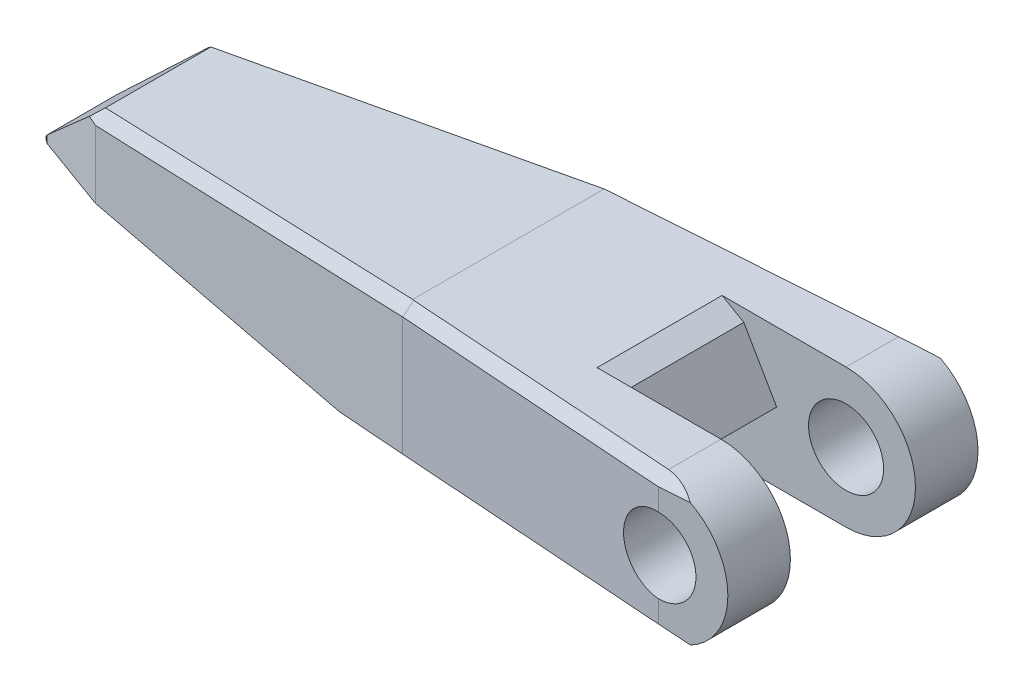
from build123d import *

# Parameters (mm, degrees)
CROQUIS1_W              = 20
CROQUIS1_H              = 27.748412894
CROQUIS1_R              = 7.5
SALIENTE_EXTRUIR1_DEPTH = 50
CORTAR_EXTRUIR4_DEPTH   = 50
CORTAR_EXTRUIR6_DEPTH   = 12.5
CHAFL_N3_START          = -1
CHAFL_N3_OUTLINE_W      = 79
CHAFL_N3_OUTLINE_H      = 9
CHAFL_N3_DEPTH          = 2.185479897
CHAFL_N4_SIZE           = 2
CHAFL_N4_SIZE_2         = 2.02158655
CHAFL_N5_START          = -33
CHAFL_N5_OUTLINE_W      = 90
CHAFL_N5_OUTLINE_H      = 7
CHAFL_N5_DEPTH          = 2.187491538
CHAFL_N6_START          = -47
CHAFL_N6_OUTLINE_W      = 78
CHAFL_N6_OUTLINE_H      = 9
CHAFL_N6_DEPTH          = 1.956109558
CHAFL_N9_START          = -12
CHAFL_N9_OUTLINE_W      = 79
CHAFL_N9_OUTLINE_H      = 9
CHAFL_N9_DEPTH          = 2.225324788
CHAFL_N10_START         = -36
CHAFL_N10_OUTLINE_W     = 65
CHAFL_N10_OUTLINE_H     = 9
CHAFL_N10_DEPTH         = 1.916264666
CROQUIS17_W             = 6
CROQUIS17_H             = 25
CORTAR_EXTRUIR8_DEPTH   = 50
CORTAR_EXTRUIR9_DEPTH   = 12.5
CORTAR_EXTRUIR10_DEPTH  = 12.5
CROQUIS22_W             = 25
CROQUIS22_H             = 11.323267037
CORTAR_EXTRUIR11_DEPTH  = 128.16446319
CROQUIS23_W             = 25
CROQUIS23_H             = 16.343664216
CORTAR_EXTRUIR12_DEPTH  = 80
CHAFL_N17_SIZE          = 9
CHAFL_N17_SIZE_2        = 8.307561118


with BuildPart() as part:
    # Croquis1 → Saliente-Extruir1 (new body)
    # profile 1 of 4: a face of its own
    with BuildSketch(Plane.XY):
        with BuildLine():
            Line((-57.030721287, -14.034703102), (-41.84315615, 0))
            Line((-41.84315615, 0), (-41.84315615, -15.5))
            Line((-41.84315615, -15.5), (-56.84315615, -15.5))
            add(Edge.make_bspline(
                [(-57.030721287, -14.034703102), (-57.299191115, -14.282793846), (-57.220648616, -14.896383781), (-57.142106118, -15.509973716), (-56.84315615, -15.5)],
                knots=[0.390549282, 0.390549282, 0.390549282, 1.766070968, 1.766070968, 3.141592654, 3.141592654, 3.141592654], degree=2, weights=[1, 0.772669387, 1, 0.772669387, 1]))
        make_face()
    # profile 2 of 4: a face of its own
    with BuildSketch(Plane.XY):
        Polygon((28.15684385, -21.624206447), (28.15684385, 6.124206447), (-41.84315615, 0), (-41.84315615, -15.5), align=None)
    # profile 3 of 4: a face of its own
    with BuildSketch(Plane.XY):
        with Locations((38.15684385, -7.75)):
            Rectangle(CROQUIS1_W, CROQUIS1_H)
    # profile 4 of 4: a face of its own
    with BuildSketch(Plane.XY):
        with BuildLine():
            Line((48.15684385, -21.624206447), (83.15684385, -21.624206447))
            ThreePointArc((83.15684385, -21.624206447), (97.031050296, -7.75), (83.15684385, 6.124206447))
            Line((83.15684385, 6.124206447), (48.15684385, 6.124206447))
            Line((48.15684385, 6.124206447), (48.15684385, -21.624206447))
        make_face()
        with Locations((83.15684385, -7.75)):
            Circle(CROQUIS1_R, mode=Mode.SUBTRACT)
    extrude(amount=SALIENTE_EXTRUIR1_DEPTH)

    # Croquis6 → Cortar-Extruir4 (cut)
    with BuildSketch(Plane(origin=(0, 6.124206447, 0), x_dir=(1, 0, 0), z_dir=(0, 1, 0))):
        Polygon((83.15684385, 0), (28.15684385, 0), (28.15684385, -3.845974657), align=None)
        Polygon((83.15684385, -50), (28.15684385, -46.154025343), (28.15684385, -50), align=None)
        Polygon((28.15684385, -50), (28.15684385, -46.154025343), (-41.84315615, -37.55910608), (-41.84315615, -50), align=None)
        Polygon((28.15684385, -3.845974657), (28.15684385, 0), (-41.84315615, 0), (-41.84315615, -12.44089392), align=None)
        Polygon((-57.233399119, 0), (-41.84315615, 0), (-41.84315615, -12.44089392), (-57.030721287, -17.968715561), (-57.233399119, -17.968715561), align=None)
        Polygon((-57.233399119, -32.031284439), (-57.233399119, -50), (-41.84315615, -50), (-41.84315615, -37.55910608), (-57.030721287, -32.031284439), align=None)
    extrude(amount=-CORTAR_EXTRUIR4_DEPTH, mode=Mode.SUBTRACT)

    # Croquis10 → Cortar-Extruir6 (cut, symmetric)
    with BuildSketch(Plane.XY.offset(25)):
        with BuildLine():
            Line((83.15684385, 6.124206447), (75.731562774, 6.124206447))
            Line((75.731562774, 6.124206447), (75.731562774, 3.970017299))
            ThreePointArc((75.731562774, 3.970017299), (69.289041207, -8.171490688), (76.457035077, -19.899327839))
            Line((76.457035077, -19.899327839), (76.457035077, -21.624206447))
            Line((76.457035077, -21.624206447), (83.15684385, -21.624206447))
            ThreePointArc((83.15684385, -21.624206447), (97.031050296, -7.75), (83.15684385, 6.124206447))
        make_face()
    extrude(amount=CORTAR_EXTRUIR6_DEPTH, both=True, mode=Mode.SUBTRACT)

    # Chaflán3: read off the stored shape, not the designer's step
    # Chaflán3 outline → Chaflán3 (cut)
    with BuildSketch(Plane(origin=(0, 0, 0), x_dir=(0.9987827677655402, 0.0349207435267313, -0.034835678350610806), z_dir=(0.04932527561612769, -0.7071067811865458, 0.7053843046066418)).offset(CHAFL_N3_START)):
        with Locations((51.5, 5.5)):
            Rectangle(CHAFL_N3_OUTLINE_W, CHAFL_N3_OUTLINE_H)
    extrude(amount=CHAFL_N3_DEPTH, mode=Mode.SUBTRACT)

    # Chaflán4
    # the kernel refuses this chamfer: 2.02158655, 2 mm, written as the material it takes off along each edge
    with BuildSketch(Plane(origin=(29.320006018, 6.22596995, 3.703156301), x_dir=(0.1209504317481252, 0.010581791626527273, 0.9926021452454729), z_dir=(-0.9888249944080325, -0.08651097722179166, 0.1214124427482008))) as chafl_n4_piece_1:
        Polygon((CHAFL_N4_SIZE, 0), (-CHAFL_N4_SIZE_2 * 0.0106216131418, -CHAFL_N4_SIZE_2 * 0.999943588993), (0, 0), align=None)
    extrude(amount=87.568441366, mode=Mode.SUBTRACT)

    # Chaflán5: read off the stored shape, not the designer's step
    # Chaflán5 outline → Chaflán5 (cut)
    with BuildSketch(Plane(origin=(0, 0, 0), x_dir=(0.9891526601001411, 0.10461310355007251, 0.1031169897855652), z_dir=(0.14689116725254298, -0.7044557654033778, -0.6943810622224129)).offset(CHAFL_N5_START)):
        with Locations((4, 27.5)):
            Rectangle(CHAFL_N5_OUTLINE_W, CHAFL_N5_OUTLINE_H)
    extrude(amount=CHAFL_N5_DEPTH, mode=Mode.SUBTRACT)

    # Chaflán6: read off the stored shape, not the designer's step
    # Chaflán6 outline → Chaflán6 (cut)
    with BuildSketch(Plane(origin=(0, 0, 0), x_dir=(0.9987827677655402, -0.034920743526731114, 0.03483567835061047), z_dir=(0.04932527561612732, 0.7071067811865474, -0.7053843046066404)).offset(CHAFL_N6_START)):
        with Locations((54, -18.5)):
            Rectangle(CHAFL_N6_OUTLINE_W, CHAFL_N6_OUTLINE_H)
    extrude(amount=CHAFL_N6_DEPTH, mode=Mode.SUBTRACT)

    # Chaflán9: read off the stored shape, not the designer's step
    # Chaflán9 outline → Chaflán9 (cut)
    with BuildSketch(Plane(origin=(0, 0, 0), x_dir=(0.9987827677655402, -0.03492074352673121, -0.03483567835061067), z_dir=(0.049325275616127526, 0.7071067811865464, 0.7053843046066414)).offset(CHAFL_N9_START)):
        with Locations((52.5, -16.5)):
            Rectangle(CHAFL_N9_OUTLINE_W, CHAFL_N9_OUTLINE_H)
    extrude(amount=CHAFL_N9_DEPTH, mode=Mode.SUBTRACT)

    # Chaflán10: read off the stored shape, not the designer's step
    # Chaflán10 outline → Chaflán10 (cut)
    with BuildSketch(Plane(origin=(0, 0, 0), x_dir=(0.9987827677655402, 0.03492074352673113, 0.034835678350610584), z_dir=(0.049325275616127415, -0.7071067811865462, -0.7053843046066413)).offset(CHAFL_N10_START)):
        with Locations((60.5, 29.5)):
            Rectangle(CHAFL_N10_OUTLINE_W, CHAFL_N10_OUTLINE_H)
    extrude(amount=CHAFL_N10_DEPTH, mode=Mode.SUBTRACT)

    # Croquis17 → Cortar-Extruir8 (cut, symmetric)
    with BuildSketch(Plane(origin=(0, 0, 0), x_dir=(1, 0, 0), z_dir=(0, 1, 0))):
        with Locations((76.444203312, -25)):
            Rectangle(CROQUIS17_W, CROQUIS17_H)
    extrude(amount=CORTAR_EXTRUIR8_DEPTH, both=True, mode=Mode.SUBTRACT)

    # Croquis19 → Cortar-Extruir9 (cut, symmetric)
    with BuildSketch(Plane.XY.offset(25)):
        Polygon((83.15684385, 6.124206447), (83.15684385, -7.75), (63.342423567, 6.124206447), align=None)
        Polygon((63.342423567, -21.624206447), (83.15684385, -7.75), (83.15684385, -21.624206447), align=None)
    extrude(amount=CORTAR_EXTRUIR9_DEPTH, both=True, mode=Mode.SUBTRACT)

    # Croquis20 → Cortar-Extruir10 (cut, symmetric)
    with BuildSketch(Plane.XY.offset(25)):
        with BuildLine():
            Line((61.272360576, 6.124206447), (69.282637403, -7.75))
            ThreePointArc((69.282637403, -7.75), (73.346298387, 2.060545462), (83.15684385, 6.124206447))
            Line((83.15684385, 6.124206447), (61.272360576, 6.124206447))
        make_face()
        with BuildLine():
            ThreePointArc((83.15684385, -21.624206447), (73.346298387, -17.560545462), (69.282637403, -7.75))
            Line((69.282637403, -7.75), (61.272360576, -21.624206447))
            Line((61.272360576, -21.624206447), (83.15684385, -21.624206447))
        make_face()
    extrude(amount=CORTAR_EXTRUIR10_DEPTH, both=True, mode=Mode.SUBTRACT)

    # Croquis22 → Cortar-Extruir11 (cut, through all)
    with BuildSketch(Plane(origin=(48.606129612, 28.062762016, 0), x_dir=(0, 0, -1), z_dir=(0.866025403784436, 0.5000000000000046, 0))):
        with Locations((-25, -47.0146491)):
            Rectangle(CROQUIS22_W, CROQUIS22_H)
    extrude(amount=-CORTAR_EXTRUIR11_DEPTH, mode=Mode.SUBTRACT)

    # Croquis23 → Cortar-Extruir12 (cut)
    with BuildSketch(Plane(origin=(100, 0, 0), x_dir=(0, 0, -1), z_dir=(1, 0, 0))):
        with Locations((-25, -20.921832108)):
            Rectangle(CROQUIS23_W, CROQUIS23_H)
    extrude(amount=-CORTAR_EXTRUIR12_DEPTH, mode=Mode.SUBTRACT)

    # Chaflán14
    # the kernel refuses this chamfer: 5 mm, written as the material it takes off along each edge
    with BuildSketch(Plane(origin=(60.622383365, -12.75, 37.5), x_dir=(0.8660254037844363, 0.5000000000000041, 0), z_dir=(0, 0, -1))) as chafl_n14_piece_1:
        with BuildLine():
            Line((1.532931127, 0.051763809), (-1.353439203, -0.72163679))
            Line((-1.353439203, -0.72163679), (-1.403439203, -0.63503425))
            ThreePointArc((-1.403439203, -0.63503425), (-0.713778649, -0.296630241), (-0.05, 0.08660254))
            Line((-0.05, 0.08660254), (0, 0.1))
            ThreePointArc((0, 0.1), (0.766465564, 0.1), (1.532931127, 0.151763809))
            Line((1.532931127, 0.151763809), (1.532931127, 0.051763809))
        make_face()
    extrude(amount=25, mode=Mode.SUBTRACT)

    # Chaflán15
    # the kernel refuses this chamfer: 5 mm, written as the material it takes off along each edge
    with BuildSketch(Plane(origin=(61.272360576, 6.124206447, 12.5), x_dir=(-1, 0, 0), z_dir=(0, 0, 1))) as chafl_n15_piece_1:
        with BuildLine():
            Line((3.059956427, -0.1), (-1.616580754, 2.6))
            Line((-1.616580754, 2.6), (-1.703183294, 2.55))
            ThreePointArc((-1.703183294, 2.55), (-0.851591647, 1.275), (-0.08660254, -0.05))
            Line((-0.08660254, -0.05), (0, -0.1))
            ThreePointArc((0, -0.1), (1.529978213, -0.1), (3.059956427, -0.2))
            Line((3.059956427, -0.2), (3.059956427, -0.1))
        make_face()
    extrude(amount=25, mode=Mode.SUBTRACT)

    # Chaflán17
    # the kernel refuses this chamfer: 9, 8.307561118 mm, written as the material it takes off along each edge
    with BuildSketch(Plane(origin=(20, -20.91057508, 12.5), x_dir=(-0.9961946980917451, 0.08715574274766211, 0), z_dir=(0, 0, 1))) as chafl_n17_piece_1_section:
        Polygon((CHAFL_N17_SIZE, 0), (CHAFL_N17_SIZE_2 * 0.0871557427526, -CHAFL_N17_SIZE_2 * 0.996194698149), (0, 0), align=None)
    chafl_n17_piece_1 = extrude(amount=25, mode=Mode.PRIVATE)
    chafl_n17_piece_1 = split(chafl_n17_piece_1, bisect_by=Plane(origin=(20, -12.75, 12.5), z_dir=(0, -1, 0)), keep=Keep.TOP, mode=Mode.PRIVATE)
    add(chafl_n17_piece_1, mode=Mode.SUBTRACT)


solid = part.part
